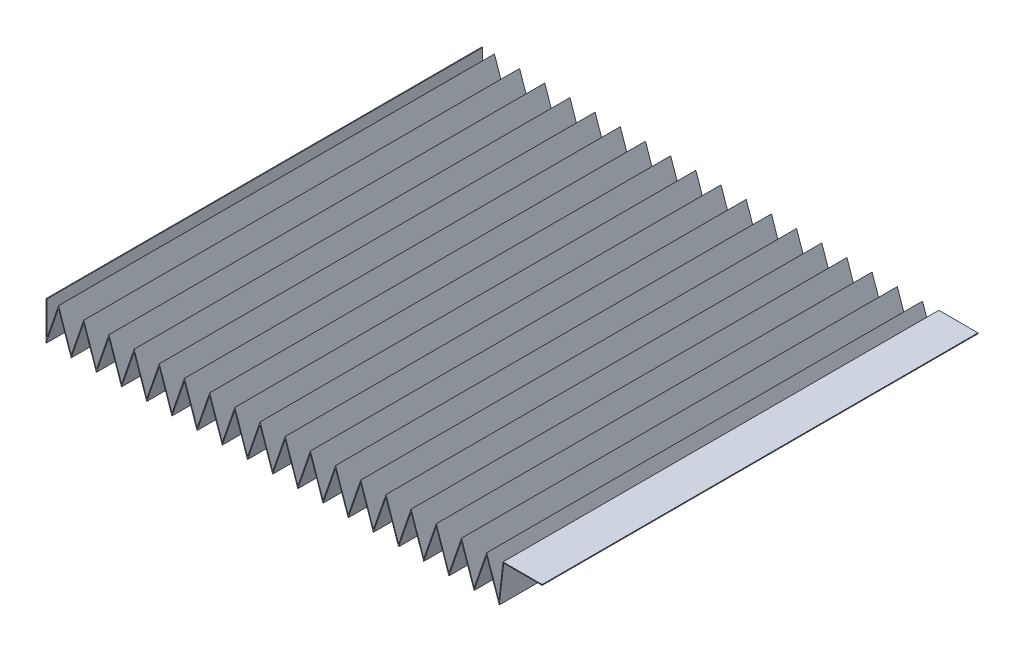
from build123d import *

# Parameters (mm, degrees)
EXTRUDE_THIN1_DEPTH = 85


with BuildPart() as part:
    # Sketch1 → Extrude-Thin1 (new, symmetric)
    with BuildSketch(Plane.XY):
        Polygon((0, 15.1), (0, 0), (4.911165201, 14.279021548), (9.822330401, 0), (14.733495602, 14.279021548), (19.644660803, 0), (24.555826004, 14.279021548), (29.466991204, 0), (34.378156405, 14.279021548), (39.289321606, 0), (44.200486807, 14.279021548), (49.111652007, 0), (54.022817208, 14.279021548), (58.933982409, 0), (63.845147609, 14.279021548), (68.75631281, 0), (73.667478011, 14.279021548), (78.578643212, 0), (83.489808412, 14.279021548), (88.400973613, 0), (93.312138814, 14.279021548), (98.223304015, 0), (103.134469215, 14.279021548), (108.045634416, 0), (112.956799617, 14.279021548), (117.867964817, 0), (122.779130018, 14.279021548), (127.690295219, 0), (132.60146042, 14.279021548), (137.51262562, 0), (142.423790821, 14.279021548), (147.334956022, 0), (152.246121223, 14.279021548), (157.157286423, 0), (162.068451624, 14.279021548), (166.979616825, 0), (171.890782025, 14.279021548), (176.801947226, 0), (178.536882383, 15), (193.536882383, 15), (193.536882383, 15.3), (178.269581087, 15.3), (176.655784828, 1.34734951), (171.890782025, 15.201409579), (166.979616825, 0.922388031), (162.068451624, 15.201409579), (157.157286423, 0.922388031), (152.246121223, 15.201409579), (147.334956022, 0.922388031), (142.423790821, 15.201409579), (137.51262562, 0.922388031), (132.60146042, 15.201409579), (127.690295219, 0.922388031), (122.779130018, 15.201409579), (117.867964817, 0.922388031), (112.956799617, 15.201409579), (108.045634416, 0.922388031), (103.134469215, 15.201409579), (98.223304015, 0.922388031), (93.312138814, 15.201409579), (88.400973613, 0.922388031), (83.489808412, 15.201409579), (78.578643212, 0.922388031), (73.667478011, 15.201409579), (68.75631281, 0.922388031), (63.845147609, 15.201409579), (58.933982409, 0.922388031), (54.022817208, 15.201409579), (49.111652007, 0.922388031), (44.200486807, 15.201409579), (39.289321606, 0.922388031), (34.378156405, 15.201409579), (29.466991204, 0.922388031), (24.555826004, 15.201409579), (19.644660803, 0.922388031), (14.733495602, 15.201409579), (9.822330401, 0.922388031), (4.911165201, 15.201409579), (0.3, 1.794626347), (0.3, 15.1), align=None)
    extrude(amount=EXTRUDE_THIN1_DEPTH, both=True)


solid = part.part
